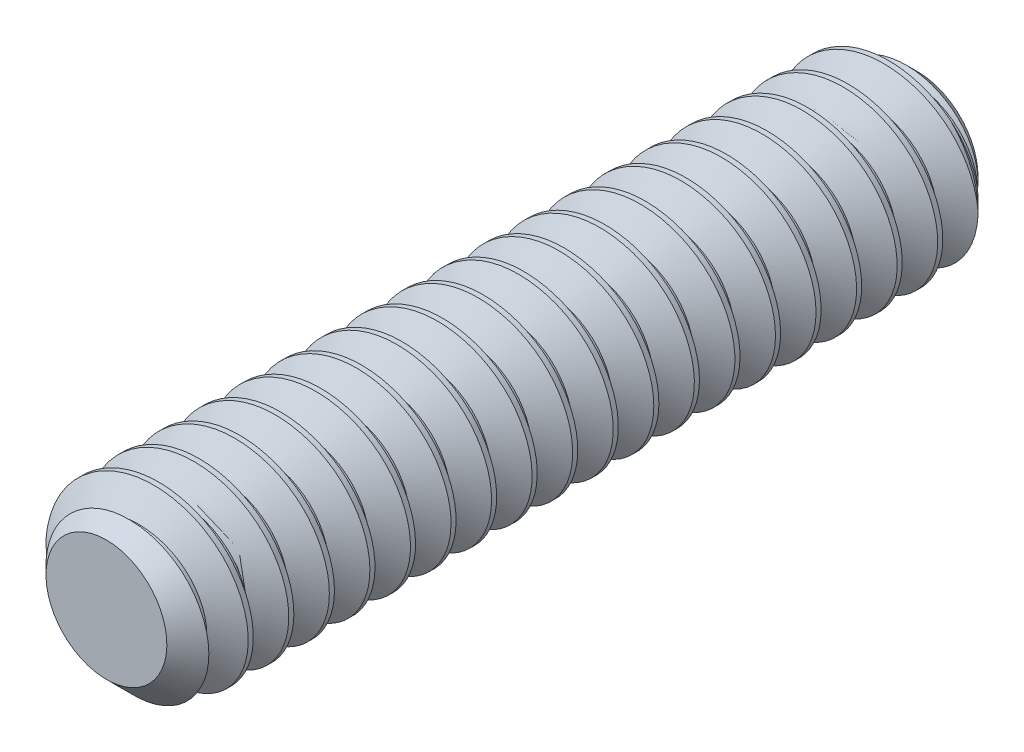
from build123d import *

# Parameters (mm, degrees)
CUT_SWEEP1_PITCH = 0.635


with BuildPart() as part:
    # Sketch3 → Revolve1 (revolve)
    with BuildSketch(Plane(origin=(0, 0, 0), x_dir=(0, 0, -1), z_dir=(1, 0, 0))):
        Polygon((-6.35, 0), (-6.35, 0.94615), (-5.87375, 1.4224), (5.87375, 1.4224), (6.35, 0.94615), (6.35, 0), align=None)
    revolve(axis=Axis((0, 0, -6.35), (0, 0, 1)))

    # Cut-Sweep1: the profile of Sketch5 screwed along a right-hand helix of 21 turns, 6 arcs to a turn; built about Z, then put on its axis
    cut_sweep1_z = Axis((0, 0, 0), (0, 0, 1))
    cut_sweep1_corners = [(1.009955401, 0, -0.3175), (1.009955401, 0, -0.238125), (1.456770383, 0, 0.01984375), (1.456770383, 0, -0.57546875)]
    with BuildLine(mode=Mode.PRIVATE) as cut_sweep1_profile:
        Line(cut_sweep1_corners[0], cut_sweep1_corners[1])
        Line(cut_sweep1_corners[1], cut_sweep1_corners[2])
        Line(cut_sweep1_corners[2], cut_sweep1_corners[3])
        Line(cut_sweep1_corners[3], cut_sweep1_corners[0])
    cut_sweep1_cap = Face(cut_sweep1_profile.wire())
    cut_sweep1_turn_angles = [0, 30, 60, 90, 120, 150, 180, 210, 240, 270, 300, 330, 360]
    cut_sweep1_turn_weights = [1, 0.8660254037844387, 1, 0.8660254037844387, 1, 0.8660254037844387, 1, 0.8660254037844387, 1, 0.8660254037844387, 1, 0.8660254037844387, 1]
    cut_sweep1_turn_rails = [Edge.make_bspline([Vector(p[0], p[1], 0).rotate(cut_sweep1_z, cut_sweep1_turn_angles[k]) / cut_sweep1_turn_weights[k] + Vector(0, 0, p[2] + CUT_SWEEP1_PITCH * cut_sweep1_turn_angles[k] / 360) for k in range(13)], [0, 0, 0, 1, 1, 2, 2, 3, 3, 4, 4, 5, 5, 6, 6, 6], 2, cut_sweep1_turn_weights) for p in cut_sweep1_corners]
    cut_sweep1_turn_sides = [Face.make_surface_from_curves(cut_sweep1_turn_rails[p[0]], cut_sweep1_turn_rails[p[1]]) for p in [(0, 1), (1, 2), (2, 3), (3, 0)]]
    cut_sweep1 = Plane(origin=(0, 0, 6.35), x_dir=(0, 1, 0), z_dir=(0, 0, -1)) * Solid(Shell([*[p.moved(Location((0, 0, CUT_SWEEP1_PITCH * i))) for i in range(21) for p in cut_sweep1_turn_sides], cut_sweep1_cap, cut_sweep1_cap.rotate(cut_sweep1_z, 7560).moved(Location((0, 0, CUT_SWEEP1_PITCH * 7560 / 360)))]))
    add(cut_sweep1, mode=Mode.SUBTRACT)


solid = part.part
